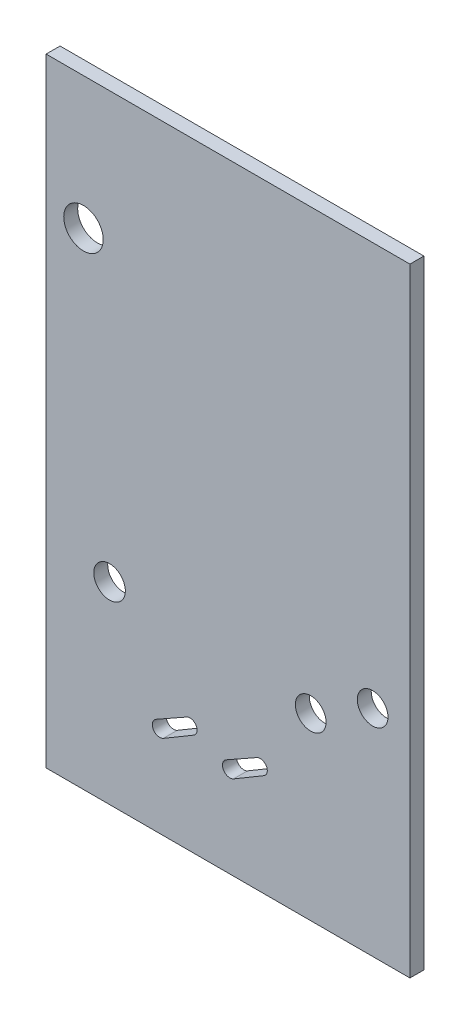
from build123d import *

# Parameters (mm, degrees)
SKETCH1_6_W         = 50.090098238
SKETCH1_6_H         = 45.932062837
SKETCH1_6_R         = 4.5
BEZEL_DEPTH         = 3.18
SKETCH1_W           = 89.29
SKETCH1_H           = 147.294272307
SKETCH1_R           = 3.6
SKETCH1_R_2         = 3.5
BODY_DEPTH          = 3.18
SKETCH1_11_W        = 50.090098238
SKETCH1_11_H        = 45.932062837
BOSS_EXTRUDE1_DEPTH = 3.18
SKETCH2_W           = 89.29
SKETCH2_H           = 147.294272307
SKETCH2_W_2         = 82.93
SKETCH2_H_2         = 140.934272307
CUT_EXTRUDE1_DEPTH  = 87.250591164


with BuildPart() as part:
    # Sketch1<6> → Bezel (new body)
    with BuildSketch(Plane.XY):
        with BuildLine():
            ThreePointArc((38.389642662, 59.990077479), (37.657409615, 61.757844432), (35.889642662, 62.490077479))
            Line((35.889642662, 62.490077479), (-35.919151108, 62.490077479))
            ThreePointArc((-35.919151108, 62.490077479), (-37.686918061, 61.757844432), (-38.419151108, 59.990077479))
            Line((-38.419151108, 59.990077479), (-38.419151108, 6.918014642))
            ThreePointArc((-38.419151108, 6.918014642), (-37.686918061, 5.150247689), (-35.919151108, 4.418014642))
            Line((-35.919151108, 4.418014642), (29.997375098, 4.418014642))
            ThreePointArc((29.997375098, 4.418014642), (35.990372343, 7.41277043), (38.389642662, 13.668014642))
            Line((38.389642662, 13.668014642), (38.389642662, 59.990077479))
        make_face()
        with Locations((-0.014754223, 33.23404606)):
            Rectangle(SKETCH1_6_W, SKETCH1_6_H, mode=Mode.SUBTRACT)
        with Locations((-32.845865367, 40.325993685)):
            Circle(SKETCH1_6_R, mode=Mode.SUBTRACT)
    extrude(amount=BEZEL_DEPTH)

    # Sketch1 → Body (add)
    with BuildSketch(Plane.XY):
        with Locations((0.105848892, -0.017058674)):
            Rectangle(SKETCH1_W, SKETCH1_H)
        with BuildLine():
            ThreePointArc((-14.641551271, -51.285483428), (-16.940439708, -50.641794665), (-16.296750946, -48.342906228))
            Line((-16.296750946, -48.342906228), (-9.324146649, -44.420816311))
            ThreePointArc((-9.324146649, -44.420816311), (-7.152105158, -45.022980632), (-7.741744524, -47.198455643))
            Line((-7.741744524, -47.198455643), (-14.641551271, -51.285483428))
        make_face(mode=Mode.SUBTRACT)
        with Locations((-26.900831216, -26.517202566)):
            Circle(SKETCH1_R, mode=Mode.SUBTRACT)
        with BuildLine():
            ThreePointArc((1.358448729, -51.285483428), (-0.940439708, -50.641794665), (-0.296750946, -48.342906228))
            Line((-0.296750946, -48.342906228), (6.675853351, -44.420816311))
            ThreePointArc((6.675853351, -44.420816311), (8.847894842, -45.022980632), (8.258255476, -47.198455643))
            Line((8.258255476, -47.198455643), (1.358448729, -51.285483428))
        make_face(mode=Mode.SUBTRACT)
        with Locations((18.957561099, -29.561304194)):
            Circle(SKETCH1_R_2, mode=Mode.SUBTRACT)
        with Locations((33.068305831, -21.491722051)):
            Circle(SKETCH1_R_2, mode=Mode.SUBTRACT)
        with BuildLine():
            Line((-35.919151108, 62.490077479), (35.889642662, 62.490077479))
            ThreePointArc((35.889642662, 62.490077479), (37.657409615, 61.757844432), (38.389642662, 59.990077479))
            Line((38.389642662, 59.990077479), (38.389642662, 13.668014642))
            ThreePointArc((38.389642662, 13.668014642), (35.990372343, 7.41277043), (29.997375098, 4.418014642))
            Line((29.997375098, 4.418014642), (-35.919151108, 4.418014642))
            ThreePointArc((-35.919151108, 4.418014642), (-37.686918061, 5.150247689), (-38.419151108, 6.918014642))
            Line((-38.419151108, 6.918014642), (-38.419151108, 59.990077479))
            ThreePointArc((-38.419151108, 59.990077479), (-37.686918061, 61.757844432), (-35.919151108, 62.490077479))
        make_face(mode=Mode.SUBTRACT)
    extrude(amount=BODY_DEPTH)

    # Sketch1<11> → Boss-Extrude1 (add)
    with BuildSketch(Plane.XY):
        with Locations((-0.014754223, 33.23404606)):
            Rectangle(SKETCH1_11_W, SKETCH1_11_H)
    extrude(amount=BOSS_EXTRUDE1_DEPTH)

    # Sketch2 → Cut-Extrude1 (cut, through all)
    with BuildSketch(Plane.XY.offset(3.18)):
        with Locations((0.105848892, -0.017058674)):
            Rectangle(SKETCH2_W, SKETCH2_H)
        with Locations((0.105848892, -0.017058674)):
            Rectangle(SKETCH2_W_2, SKETCH2_H_2, mode=Mode.SUBTRACT)
    extrude(amount=-CUT_EXTRUDE1_DEPTH, mode=Mode.SUBTRACT)


solid = part.part
